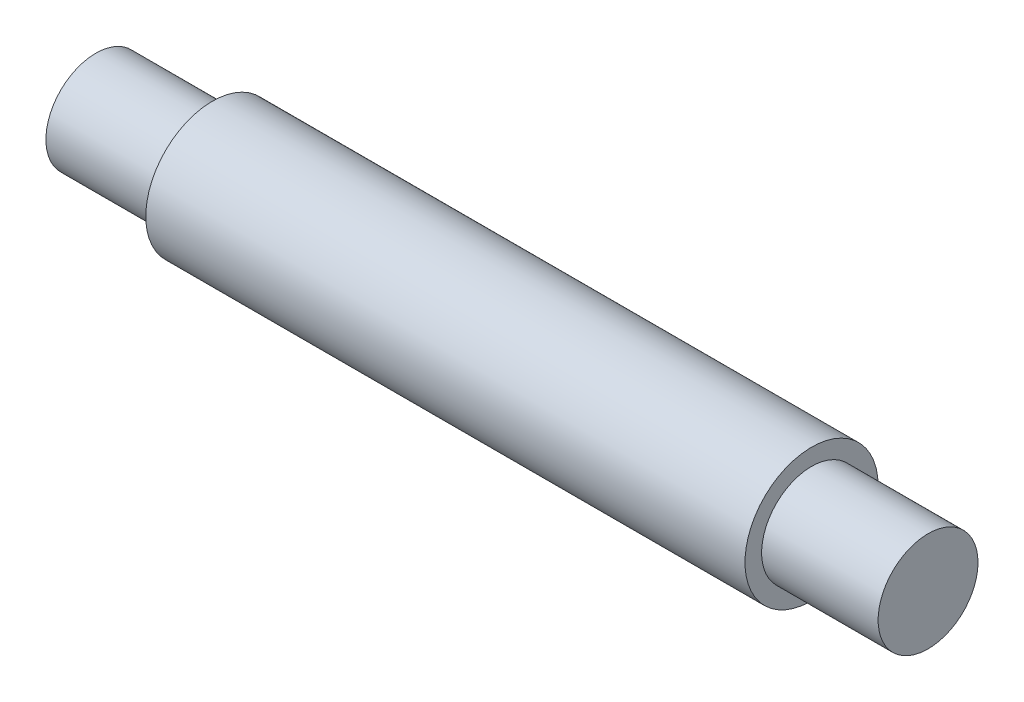
from build123d import *

# Parameters (mm, degrees)
SKETCH1_R           = 4
BOSS_EXTRUDE1_DEPTH = 18
SKETCH2_R           = 3
BOSS_EXTRUDE2_DEPTH = 7


with BuildPart() as part:
    # Sketch1 → Boss-Extrude1 (new body)
    with BuildSketch(Plane.YZ):
        Circle(SKETCH1_R)
    extrude(amount=BOSS_EXTRUDE1_DEPTH)

    # Sketch2 → Boss-Extrude2 (add)
    with BuildSketch(Plane.YZ.offset(18)):
        Circle(SKETCH2_R)
    extrude(amount=BOSS_EXTRUDE2_DEPTH)

    # Mirror1: part across plane


with BuildPart() as part_1:
    add(part.part)
    add(part.part.mirror(Plane(origin=(0, 0, 0), x_dir=(0, 0, 1), z_dir=(1, 0, 0))))


solid = part_1.part
